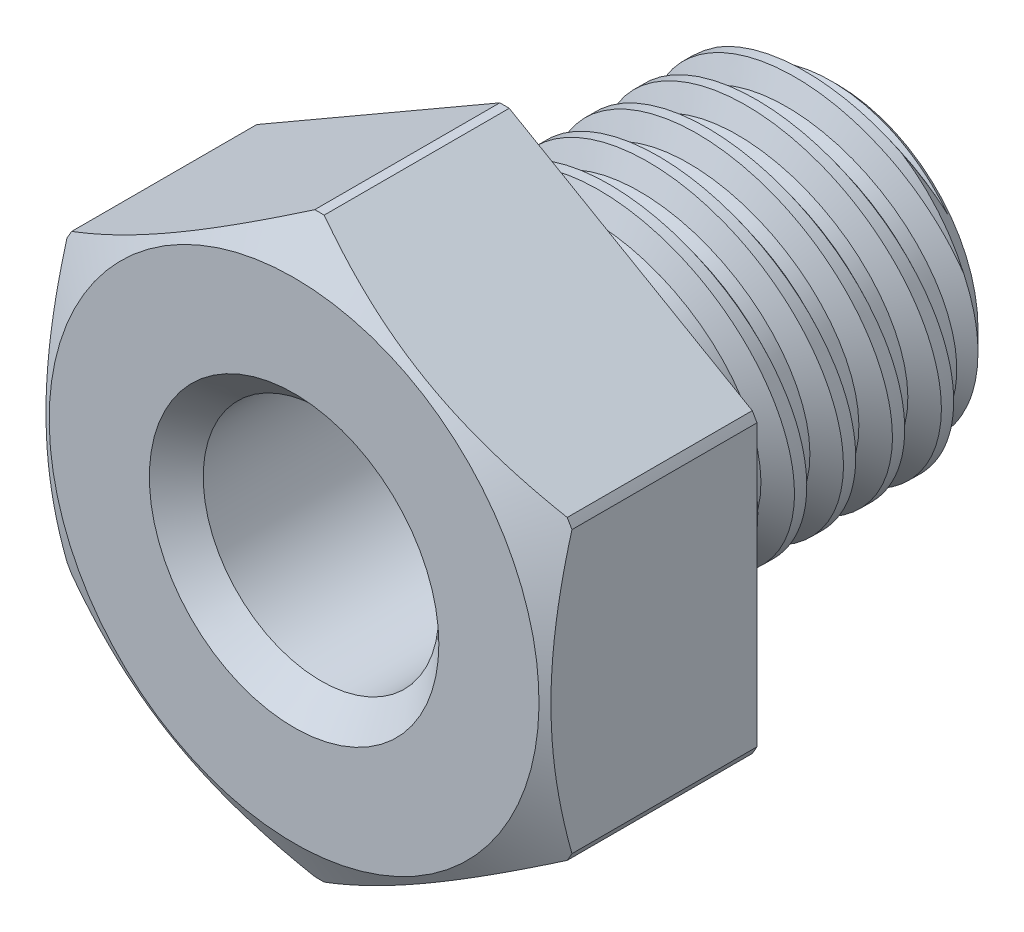
from build123d import *

# Parameters (mm, degrees)
SKETCH1_W            = 38.1
SKETCH1_H            = 7.9375
LPATTERN1_COUNT      = 2
LPATTERN1_PITCH      = 2.309090909
LPATTERN1_COUNT_DIR2 = 17
LPATTERN1_PITCH_DIR2 = 2.309090909
EXTRUDE1_DEPTH       = 9.921875
CUT_EXTRUDE1_REACH   = 33.508
SKETCH7_R            = 8.804283697
SKETCH9_R            = 5.55625
CUT_EXTRUDE2_DEPTH   = 32.508306378
CHAMFER1_SIZE        = 1.27


with BuildPart() as part:
    # Sketch1 → Revolve1 (revolve)
    with BuildSketch(Plane(origin=(0, 0, 0), x_dir=(0, 0, -1), z_dir=(1, 0, 0))):
        with Locations((0, 3.96875)):
            Rectangle(SKETCH1_W, SKETCH1_H)
    revolve(axis=Axis((0, 0, 19.05), (0, 0, 1)))

    # Sketch2 → Cut-Revolve1 (revolve, cut)
    with BuildSketch(Plane(origin=(0, 0, 0), x_dir=(0, 0, -1), z_dir=(1, 0, 0)), mode=Mode.PRIVATE) as cut_revolve1_sk:
        Polygon((-16.764954949, 8.269870189), (-18.764369369, 7.979046274), (-17.870392148, 6.846095044), (-17.299130886, 6.929187591), align=None)
    cut_revolve1 = revolve(cut_revolve1_sk.sketch.rotate(Axis((0, -0.358847596, 19.05), (0, 0.14393984571411128, -0.9895864392845114)), 180), axis=Axis((0, -0.358847596, 19.05), (0, 0.14393984571411128, -0.9895864392845114)), mode=Mode.SUBTRACT)

    # Sketch3 → Cut-Revolve2 (revolve, cut)
    with BuildSketch(Plane(origin=(0, 0, 0), x_dir=(0, 0, -1), z_dir=(1, 0, 0)), mode=Mode.PRIVATE) as cut_revolve2_sk:
        Polygon((16.709474518, 7.9375), (19.05, 6.846095044), (19.05, 7.9375), align=None)
    revolve(cut_revolve2_sk.sketch.rotate(Axis((0, 0, 0), (0, 0, -1)), 90), axis=Axis((0, 0, 0), (0, 0, -1)), mode=Mode.SUBTRACT)

    # LPattern1: Cut-Revolve1 2 × 17
    with Locations(*[Vector(0, 0, 1) * (i * LPATTERN1_PITCH) + Vector(0, 0, -1) * (j * LPATTERN1_PITCH_DIR2) for i in range(LPATTERN1_COUNT) for j in range(LPATTERN1_COUNT_DIR2) if (i, j) != (0, 0)]):
        add(cut_revolve1, mode=Mode.SUBTRACT)

    # Sketch5 → Extrude1 (add)
    with BuildSketch(Plane.XY.offset(19.05)):
        Polygon((0, 13.748153285), (-11.90625, 6.874076643), (-11.90625, -6.874076643), (0, -13.748153285), (11.90625, -6.874076643), (11.90625, 6.874076643), align=None)
    extrude(amount=EXTRUDE1_DEPTH)

    # Sketch6 → Cut-Revolve3 (revolve, cut)
    with BuildSketch(Plane(origin=(0, 0, 0), x_dir=(0, 0, -1), z_dir=(1, 0, 0)), mode=Mode.PRIVATE) as cut_revolve3_sk:
        Polygon((-28.971875, 11.5490625), (-27.775552827, 13.621153285), (-19.05, 13.621153285), (-19.05, 14.129153285), (-28.971875, 14.129153285), align=None)
    revolve(cut_revolve3_sk.sketch.rotate(Axis((0, 0, 0), (0, 0, 1)), 124.777160539), axis=Axis((0, 0, 0), (0, 0, 1)), mode=Mode.SUBTRACT)

    # Sketch7 → Cut-Extrude1 (cut, up to next)
    with BuildSketch(Plane(origin=(0, 0, 3.175), x_dir=(-1, 0, 0), z_dir=(0, 0, -1)), mode=Mode.PRIVATE) as cut_extrude1_sk1:
        Circle(SKETCH7_R)
    cut_extrude1_tool1 = extrude(cut_extrude1_sk1.sketch, amount=CUT_EXTRUDE1_REACH, mode=Mode.PRIVATE) & part.part
    add(cut_extrude1_tool1.solids().sort_by_distance((0, 0, 3.175))[0], mode=Mode.SUBTRACT)

    # Sketch8 → Cut-Revolve4 (revolve, cut)
    with BuildSketch(Plane(origin=(0, 0, 0), x_dir=(0, 0, -1), z_dir=(1, 0, 0)), mode=Mode.PRIVATE) as cut_revolve4_sk:
        Polygon((-5.715, 8.993624096), (-3.175, 6.453624096), (-3.175, 8.993624096), align=None)
    revolve(cut_revolve4_sk.sketch.rotate(Axis((0, 0, 0), (0, 0, 1)), 124.777160539), axis=Axis((0, 0, 0), (0, 0, 1)), mode=Mode.SUBTRACT)

    # Sketch9 → Cut-Extrude2 (cut, through all)
    with BuildSketch(Plane.XY.offset(28.971875)):
        Circle(SKETCH9_R)
    extrude(amount=-CUT_EXTRUDE2_DEPTH, mode=Mode.SUBTRACT)

    # Chamfer1
    # the kernel refuses this chamfer: 1.27 mm, written as the material it takes off along each edge
    with BuildSketch(Plane(origin=(0, 0, 28.971875), x_dir=(1, 0, 0), z_dir=(0, -1, 0))) as chamfer1_piece_1:
        Polygon((5.55625 + CHAMFER1_SIZE, 0), (5.55625, -CHAMFER1_SIZE), (5.55625, 0), align=None)
    revolve(axis=Axis((0, 0, 28.971875), (0, 0, 1)), mode=Mode.SUBTRACT)
    with BuildSketch(Plane(origin=(0, 0, 3.175), x_dir=(1, 0, 0), z_dir=(0, -1, 0))) as chamfer1_piece_2:
        Polygon((5.55625, CHAMFER1_SIZE), (5.55625 + CHAMFER1_SIZE, 0), (5.55625, 0), align=None)
    revolve(axis=Axis((0, 0, 3.175), (0, 0, 1)), mode=Mode.SUBTRACT)


solid = part.part
